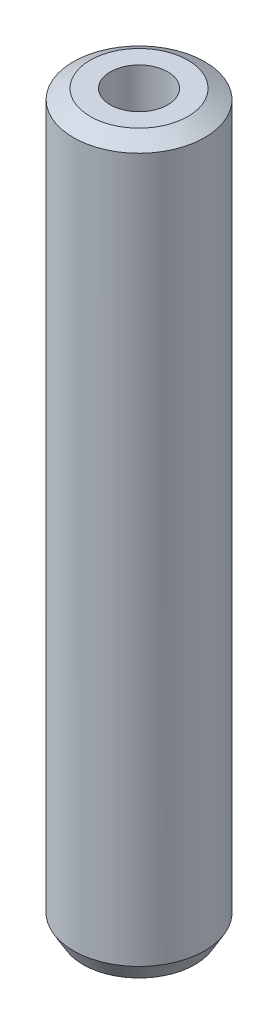
from build123d import *
from OCP.BRepFilletAPI import BRepFilletAPI_MakeChamfer

# Parameters (mm, degrees)
SKETCH1_R           = 35
BOSS_EXTRUDE1_DEPTH = 389.143097083
SKETCH2_R           = 15.270712407
CUT_EXTRUDE1_DEPTH  = 393.278408796
CHAMFER1_SIZE       = 5.204277605
CHAMFER1_SIZE2      = 9.014073229


with BuildPart() as part:
    # Sketch1 → Boss-Extrude1 (new body)
    with BuildSketch(Plane(origin=(0, 0, 0), x_dir=(1, 0, 0), z_dir=(0, 1, 0))):
        Circle(SKETCH1_R)
    extrude(amount=BOSS_EXTRUDE1_DEPTH)

    # Sketch2 → Cut-Extrude1 (cut, through all)
    with BuildSketch(Plane(origin=(0, 0, 0), x_dir=(1, 0, 0), z_dir=(0, 1, 0))):
        Circle(SKETCH2_R)
    extrude(amount=CUT_EXTRUDE1_DEPTH, mode=Mode.SUBTRACT)

    # Chamfer1: one chamfer whose edges measure the first distance from different faces: ONE call of the kernel's chamfer builder (chamfer() names one face for all edges)
    chamfer1_edges_1 = [part.edges().sort_by_distance(p)[0] for p in [
        (-35, 389.143097083, 0),
    ]]
    chamfer1_side_1 = [part.faces().sort_by_distance(p)[0] for p in [
        (-35, 194.571548541, 0),
    ]]
    chamfer1_edges_2 = [part.edges().sort_by_distance(p)[0] for p in [
        (-35, 0, 0),
    ]]
    chamfer1_side_2 = [part.faces().sort_by_distance(p)[0] for p in [
        (-34.010050506, 0, 0),
    ]]
    chamfer1 = BRepFilletAPI_MakeChamfer(part.part.solid().wrapped)
    for e in chamfer1_edges_1:
        chamfer1.Add(CHAMFER1_SIZE, CHAMFER1_SIZE2, e.wrapped, chamfer1_side_1[0].wrapped)  # the first distance lies on this face
    for e in chamfer1_edges_2:
        chamfer1.Add(CHAMFER1_SIZE, CHAMFER1_SIZE2, e.wrapped, chamfer1_side_2[0].wrapped)  # the first distance lies on this face
    add(Compound.cast(chamfer1.Shape()), mode=Mode.REPLACE)


solid = part.part
